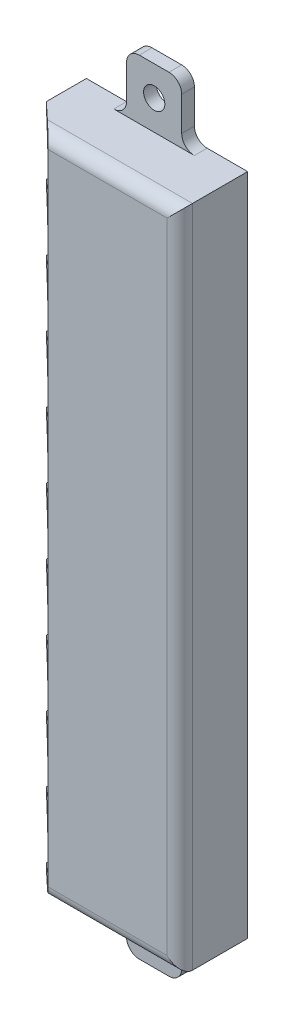
from build123d import *

# Parameters (mm, degrees)
SKETCH_1_W          = 38
SKETCH_1_H          = 16
EXTRUDE_1_DEPTH     = 156.5
SKETCH_2_R          = 7.5
CUT_EXTRUDE_1_DEPTH = 34
SKETCH_3_W          = 13
SKETCH_3_H          = 3
EXTRUDE_2_DEPTH     = 14
SKETCH_5_R          = 2.5
CUT_EXTRUDE_2_DEPTH = 3
FILLET_1_R          = 3
CUT_EXTRUDE_3_DEPTH = 156.5
MIRROR_START        = -8
MIRROR_10_OUTLINE_R = 2.5
MIRROR_10_DEPTH     = 3
FILLET_9_R          = 3
FILLET_10_R         = 3


# Read off the part's stored shape, not the designer's step: Зеркальное отражение10
with BuildPart() as part:
    # Эскиз1 → Бобышка-Вытянуть1 (new body)
    with BuildSketch(Plane(origin=(0, 0, 0), x_dir=(1, 0, 0), z_dir=(0, 1, 0))):
        Rectangle(SKETCH_1_W, SKETCH_1_H)
    extrude(amount=EXTRUDE_1_DEPTH)

    # Эскиз2 → Вырез-Вытянуть1 (cut)
    with BuildSketch(Plane.ZY.offset(19)):
        with Locations((0, 8.5)):
            Circle(SKETCH_2_R)
        with Locations((0, 24)):
            Circle(SKETCH_2_R)
        with Locations((0, 39.5)):
            Circle(SKETCH_2_R)
        with Locations((0, 55)):
            Circle(SKETCH_2_R)
        with Locations((0, 70.5)):
            Circle(SKETCH_2_R)
        with Locations((0, 86)):
            Circle(SKETCH_2_R)
        with Locations((0, 101.5)):
            Circle(SKETCH_2_R)
        with Locations((0, 117)):
            Circle(SKETCH_2_R)
        with Locations((0, 132.5)):
            Circle(SKETCH_2_R)
        with Locations((0, 148)):
            Circle(SKETCH_2_R)
    extrude(amount=-CUT_EXTRUDE_1_DEPTH, mode=Mode.SUBTRACT)

    # Эскиз3 → Бобышка-Вытянуть2 (add)
    with BuildSketch(Plane(origin=(0, 156.5, 0), x_dir=(1, 0, 0), z_dir=(0, 1, 0))):
        with Locations((-0.046570885, 6.5)):
            Rectangle(SKETCH_3_W, SKETCH_3_H)
    extrude(amount=EXTRUDE_2_DEPTH)

    # Эскиз5 → Вырез-Вытянуть2 (cut)
    with BuildSketch(Plane.XY.offset(-5)):
        with Locations((-0.023285442, 163.5)):
            Circle(SKETCH_5_R)
    extrude(amount=-CUT_EXTRUDE_2_DEPTH, mode=Mode.SUBTRACT)

    # Скругление1
    fillet_1_edges = [part.edges().sort_by_distance(p)[0] for p in [
        (-6.546570885, 156.5, -6.5),
        (6.453429115, 156.5, -6.5),
        (-6.546570885, 170.5, -6.5),
        (6.453429115, 170.5, -6.5),
    ]]
    fillet(fillet_1_edges, radius=FILLET_1_R)

    # Эскиз6 → Вырез-Вытянуть3 (cut)
    with BuildSketch(Plane.XZ):
        Polygon((-19, 1.441804302), (-12, 8), (-19, 8), align=None)
    extrude(amount=-CUT_EXTRUDE_3_DEPTH, mode=Mode.SUBTRACT)

    # Зеркальное отражение10 outline → Зеркальное отражение10 (add)
    with BuildSketch(Plane.XY.offset(MIRROR_START)):
        with BuildLine():
            Line((6.453429115, 0), (-6.546570885, 0))
            Line((-6.546570885, 0), (-6.546570885, -11))
            ThreePointArc((-6.546570885, -11), (-5.667891229, -13.121320343), (-3.546570885, -14))
            Line((-3.546570885, -14), (3.453429115, -14))
            ThreePointArc((3.453429115, -14), (5.574749459, -13.121320344), (6.453429115, -11))
            Line((6.453429115, -11), (6.453429115, 0))
        make_face()
        with Locations((-0.023285442, -7)):
            Circle(MIRROR_10_OUTLINE_R, mode=Mode.SUBTRACT)
    extrude(amount=MIRROR_10_DEPTH)

    # Скругление9
    fillet_9_edges = [part.edges().sort_by_distance(p)[0] for p in [
        (-6.546570885, 0, -6.5),
        (6.453429115, 0, -6.5),
    ]]
    fillet(fillet_9_edges, radius=FILLET_9_R)

    # Скругление10
    fillet_10_edges = [part.edges().sort_by_distance(p)[0] for p in [
        (3.5, 0, 8),
        (3.5, 156.5, 8),
        (19, 78.25, 8),
    ]]
    fillet(fillet_10_edges, radius=FILLET_10_R)


solid = part.part
